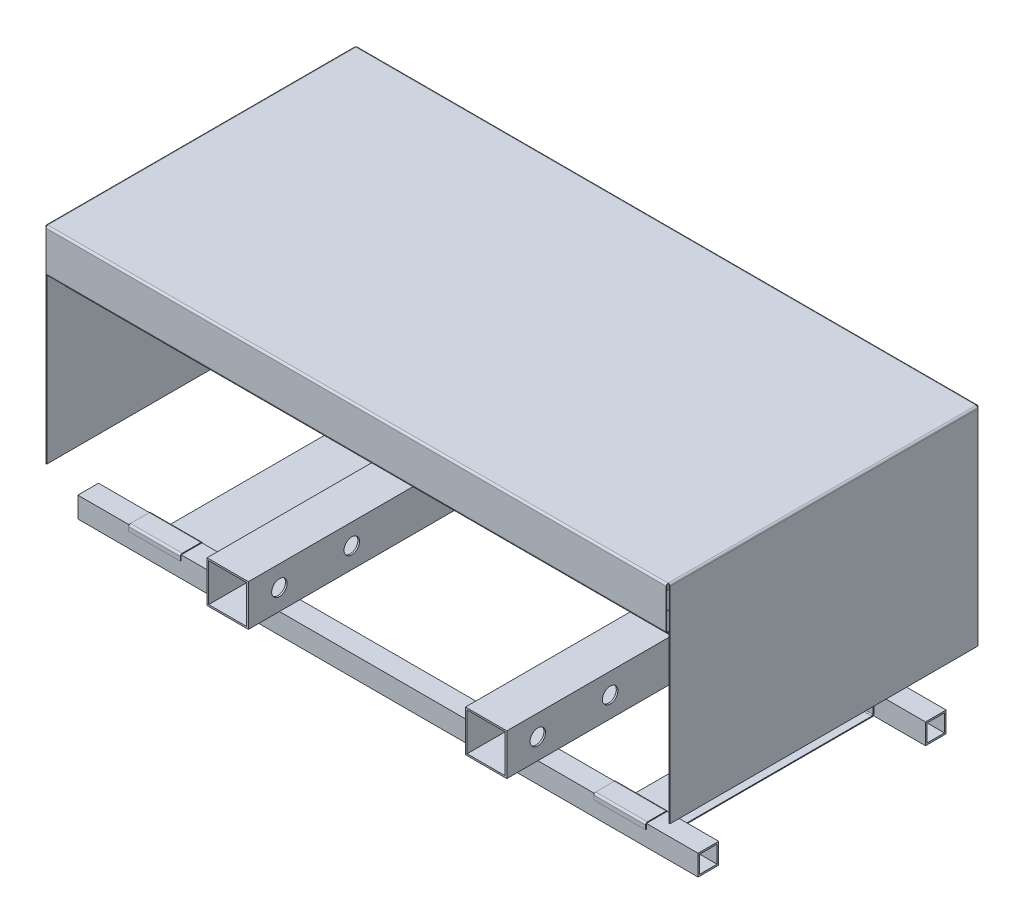
from build123d import *

# Parameters (mm, degrees)
CROQUIS11_W                      = 40
CROQUIS11_H                      = 40
CROQUIS11_W_2                    = 36.8
CROQUIS11_H_2                    = 36.8
CUADRADO_40X40X1_6_1_DEPTH       = 300
CROQUIS11_ON_SEGMENT_2_W         = 40
CROQUIS11_ON_SEGMENT_2_H         = 40
CROQUIS11_ON_SEGMENT_2_W_2       = 36.8
CROQUIS11_ON_SEGMENT_2_H_2       = 36.8
CUADRADO_40X40X1_6_1_2_DEPTH     = 300
CORTAR_EXTRUIR1_DEPTH            = 329.937684068
CORTAR_EXTRUIR1_DEPTH_BACK       = 329.937684068
CROQUIS12_R                      = 7.5
CUADRADO_START                   = -20
CUADRADO_20X20X1_6_1_OUTLINE_W   = 600
CUADRADO_20X20X1_6_1_OUTLINE_H   = 1.6
CUADRADO_20X20X1_6_1_DEPTH       = 20
CUADRADO_20X20X1_6_1_2_OUTLINE_W = 600
CUADRADO_20X20X1_6_1_2_OUTLINE_H = 16.8
CUADRADO_20X20X1_6_1_2_DEPTH     = 1.6
CUADRADO_START_2                 = -1.6
CUADRADO_20X20X1_6_1_3_OUTLINE_W = 600
CUADRADO_20X20X1_6_1_3_OUTLINE_H = 16.8
CUADRADO_20X20X1_6_1_3_DEPTH     = 1.6
CUADRADO_20X20X1_6_1_4_OUTLINE_W = 600
CUADRADO_20X20X1_6_1_4_OUTLINE_H = 1.6
CUADRADO_20X20X1_6_1_4_DEPTH     = 20
CUADRADO_20X20X1_6_1_5_OUTLINE_W = 600
CUADRADO_20X20X1_6_1_5_OUTLINE_H = 16.8
CUADRADO_20X20X1_6_1_5_DEPTH     = 1.6
CUADRADO_20X20X1_6_1_6_OUTLINE_W = 600
CUADRADO_20X20X1_6_1_6_OUTLINE_H = 16.8
CUADRADO_20X20X1_6_1_6_DEPTH     = 1.6
BRIDA_BASE1_DEPTH                = 50
BRIDA_START                      = -300
BRIDA_BASE2_DEPTH                = 600
BRIDA_DE_ARISTA1_DEPTH           = 298
BRIDA_DE_ARISTA1_BEND_DEPTH      = 298


# Read off the part's stored shape, not the designer's step: Cuadrado 20X20X1.6(1)
# Sheet-metal steps are written as plain solids
with BuildPart() as part:
    # Croquis11 → Cuadrado 40X40X1.6(1) (new body)
    with BuildSketch(Plane(origin=(-125, 20, 150), x_dir=(-1, 0, 0), z_dir=(0, 0, -1))):
        Rectangle(CROQUIS11_W, CROQUIS11_H)
        Rectangle(CROQUIS11_W_2, CROQUIS11_H_2, mode=Mode.SUBTRACT)
    extrude(amount=CUADRADO_40X40X1_6_1_DEPTH)


with BuildPart() as body_2:
    # Croquis11 on segment 2 (carried to segment 2) → Cuadrado 40X40X1.6_1 2 (new body)
    with BuildSketch(Plane(origin=(125, 20, 150), x_dir=(-1, 0, 0), z_dir=(0, 0, -1))):
        Rectangle(CROQUIS11_ON_SEGMENT_2_W, CROQUIS11_ON_SEGMENT_2_H)
        Rectangle(CROQUIS11_ON_SEGMENT_2_W_2, CROQUIS11_ON_SEGMENT_2_H_2, mode=Mode.SUBTRACT)
    extrude(amount=CUADRADO_40X40X1_6_1_2_DEPTH)


with BuildPart() as cortar_extruir1_tool:
    # Croquis12 → Cortar-Extruir1 (new, two sides: drawn at the far end of the back side and taken through both)
    with BuildSketch(Plane.ZY.offset(145).offset(-CORTAR_EXTRUIR1_DEPTH_BACK)):
        with Locations(Location((120, 20, 0), (0, 0, 180))):
            Circle(CROQUIS12_R)
        with Locations(Location((50, 20, 0), (0, 0, 180))):
            Circle(CROQUIS12_R)
        with Locations(Location((-50, 20, 0), (0, 0, 180))):
            Circle(CROQUIS12_R)
        with Locations(Location((-120, 20, 0), (0, 0, 180))):
            Circle(CROQUIS12_R)
    extrude(amount=CORTAR_EXTRUIR1_DEPTH + CORTAR_EXTRUIR1_DEPTH_BACK)


with BuildPart() as part_1:
    add(part.part)

    # Cortar-Extruir1: cut by cortar_extruir1_tool
    add(cortar_extruir1_tool.part, mode=Mode.SUBTRACT)


with BuildPart() as body_2_1:
    add(body_2.part)

    # Cortar-Extruir1: cut by cortar_extruir1_tool
    add(cortar_extruir1_tool.part, mode=Mode.SUBTRACT)


with BuildPart() as body_3:
    # Cuadrado 20X20X1.6(1) outline → Cuadrado 20X20X1.6(1) (new body)
    with BuildSketch(Plane(origin=(0, 0, 0), x_dir=(1, 0, 0), z_dir=(0, 1, 0)).offset(CUADRADO_START)):
        with Locations((0, 119.2)):
            Rectangle(CUADRADO_20X20X1_6_1_OUTLINE_W, CUADRADO_20X20X1_6_1_OUTLINE_H)
        with Locations((0, 100.8)):
            Rectangle(CUADRADO_20X20X1_6_1_OUTLINE_W, CUADRADO_20X20X1_6_1_OUTLINE_H)
    extrude(amount=CUADRADO_20X20X1_6_1_DEPTH)

    # Cuadrado 20X20X1.6_1 2 outline → Cuadrado 20X20X1.6_1 2 (add)
    with BuildSketch(Plane(origin=(0, 0, 0), x_dir=(1, 0, 0), z_dir=(0, 1, 0)).offset(CUADRADO_START)):
        with Locations((0, 110)):
            Rectangle(CUADRADO_20X20X1_6_1_2_OUTLINE_W, CUADRADO_20X20X1_6_1_2_OUTLINE_H)
    extrude(amount=CUADRADO_20X20X1_6_1_2_DEPTH)

    # Cuadrado 20X20X1.6_1 3 outline → Cuadrado 20X20X1.6_1 3 (add)
    with BuildSketch(Plane(origin=(0, 0, 0), x_dir=(1, 0, 0), z_dir=(0, 1, 0)).offset(CUADRADO_START_2)):
        with Locations((0, 110)):
            Rectangle(CUADRADO_20X20X1_6_1_3_OUTLINE_W, CUADRADO_20X20X1_6_1_3_OUTLINE_H)
    extrude(amount=CUADRADO_20X20X1_6_1_3_DEPTH)


with BuildPart() as body_4:
    # Cuadrado 20X20X1.6_1 4 outline → Cuadrado 20X20X1.6_1 4 (new body)
    with BuildSketch(Plane(origin=(0, 0, 0), x_dir=(1, 0, 0), z_dir=(0, 1, 0)).offset(CUADRADO_START)):
        with Locations((0, -100.8)):
            Rectangle(CUADRADO_20X20X1_6_1_4_OUTLINE_W, CUADRADO_20X20X1_6_1_4_OUTLINE_H)
        with Locations((0, -119.2)):
            Rectangle(CUADRADO_20X20X1_6_1_4_OUTLINE_W, CUADRADO_20X20X1_6_1_4_OUTLINE_H)
    extrude(amount=CUADRADO_20X20X1_6_1_4_DEPTH)

    # Cuadrado 20X20X1.6_1 5 outline → Cuadrado 20X20X1.6_1 5 (add)
    with BuildSketch(Plane(origin=(0, 0, 0), x_dir=(1, 0, 0), z_dir=(0, 1, 0)).offset(CUADRADO_START)):
        with Locations((0, -110)):
            Rectangle(CUADRADO_20X20X1_6_1_5_OUTLINE_W, CUADRADO_20X20X1_6_1_5_OUTLINE_H)
    extrude(amount=CUADRADO_20X20X1_6_1_5_DEPTH)

    # Cuadrado 20X20X1.6_1 6 outline → Cuadrado 20X20X1.6_1 6 (add)
    with BuildSketch(Plane(origin=(0, 0, 0), x_dir=(1, 0, 0), z_dir=(0, 1, 0)).offset(CUADRADO_START_2)):
        with Locations((0, -110)):
            Rectangle(CUADRADO_20X20X1_6_1_6_OUTLINE_W, CUADRADO_20X20X1_6_1_6_OUTLINE_H)
    extrude(amount=CUADRADO_20X20X1_6_1_6_DEPTH)


with BuildPart() as body_5:
    # Croquis15 → Brida base1 (new body)
    with BuildSketch(Plane.ZY.offset(250)):
        with BuildLine():
            Line((-120, -5), (-120, -1))
            ThreePointArc((-120, -1), (-119.707106781, -0.292893219), (-119, 0))
            Line((-119, 0), (-101, 0))
            ThreePointArc((-101, 0), (-100.292893219, -0.292893219), (-100, -1))
            Line((-100, -1), (-100, -18.2))
            ThreePointArc((-100, -18.2), (-99.472792206, -19.472792206), (-98.2, -20))
            Line((-98.2, -20), (98.2, -20))
            ThreePointArc((98.2, -20), (99.472792206, -19.472792206), (100, -18.2))
            Line((100, -18.2), (100, -1))
            ThreePointArc((100, -1), (100.292893219, -0.292893219), (101, 0))
            Line((101, 0), (119, 0))
            ThreePointArc((119, 0), (119.707106781, -0.292893219), (120, -1))
            Line((120, -1), (120, -5))
            Line((120, -5), (120.8, -5))
            Line((120.8, -5), (120.8, -1))
            ThreePointArc((120.8, -1), (120.272792206, 0.272792206), (119, 0.8))
            Line((119, 0.8), (101, 0.8))
            ThreePointArc((101, 0.8), (99.727207794, 0.272792206), (99.2, -1))
            Line((99.2, -1), (99.2, -18.2))
            ThreePointArc((99.2, -18.2), (98.907106781, -18.907106781), (98.2, -19.2))
            Line((98.2, -19.2), (-98.2, -19.2))
            ThreePointArc((-98.2, -19.2), (-98.907106781, -18.907106781), (-99.2, -18.2))
            Line((-99.2, -18.2), (-99.2, -1))
            ThreePointArc((-99.2, -1), (-99.727207794, 0.272792206), (-101, 0.8))
            Line((-101, 0.8), (-119, 0.8))
            ThreePointArc((-119, 0.8), (-120.272792206, 0.272792206), (-120.8, -1))
            Line((-120.8, -1), (-120.8, -5))
            Line((-120.8, -5), (-120, -5))
        make_face()
    extrude(amount=-BRIDA_BASE1_DEPTH)


with BuildPart() as body_6:
    # Simetría1: mirrored copy
    add(body_5.part.mirror(Plane(origin=(0, 0, 0), x_dir=(0, 0, 1), z_dir=(1, 0, 0))))


with BuildPart() as body_7:
    # Croquis22 → Brida base2 (new body)
    with BuildSketch(Plane(origin=(0, 0, 0), x_dir=(0, 0, -1), z_dir=(1, 0, 0)).offset(BRIDA_START)):
        with BuildLine():
            Line((150, 40), (150, 239))
            ThreePointArc((150, 239), (149.707106781, 239.707106781), (149, 240))
            Line((149, 240), (-149, 240))
            ThreePointArc((-149, 240), (-149.707106781, 239.707106781), (-150, 239))
            Line((-150, 239), (-150, 201))
            ThreePointArc((-150, 201), (-149.707106781, 200.292893219), (-149, 200))
            Line((-149, 200), (-131.8, 200))
            ThreePointArc((-131.8, 200), (-130.527207794, 199.472792206), (-130, 198.2))
            Line((-130, 198.2), (-130, 180))
            Line((-130, 180), (-130.8, 180))
            Line((-130.8, 180), (-130.8, 198.2))
            ThreePointArc((-130.8, 198.2), (-131.092893219, 198.907106781), (-131.8, 199.2))
            Line((-131.8, 199.2), (-149, 199.2))
            ThreePointArc((-149, 199.2), (-150.272792206, 199.727207794), (-150.8, 201))
            Line((-150.8, 201), (-150.8, 239))
            ThreePointArc((-150.8, 239), (-150.272792206, 240.272792206), (-149, 240.8))
            Line((-149, 240.8), (149, 240.8))
            ThreePointArc((149, 240.8), (150.272792206, 240.272792206), (150.8, 239))
            Line((150.8, 239), (150.8, 40))
            Line((150.8, 40), (150, 40))
        make_face()
    extrude(amount=BRIDA_BASE2_DEPTH)

    # Brida de arista1 section (across the edge) → Brida de arista1 (add)
    with BuildSketch(Plane(origin=(301, 240, -149), x_dir=(-1, 0, 0), z_dir=(0, 0, 1))):
        with BuildLine():
            Line((-0.8, 1), (-0.8, 200))
            Line((-0.8, 200), (0, 200))
            Line((0, 200), (0, 1))
            ThreePointArc((0, 1), (0.292893219, 0.292893219), (1, 0))
            Line((1, 0), (1, -0.8))
            ThreePointArc((1, -0.8), (-0.272792206, -0.272792206), (-0.8, 1))
        make_face()
    extrude(amount=BRIDA_DE_ARISTA1_DEPTH)

    # Brida de arista1 section 2 (across the edge) → Brida de arista1 bend (add)
    with BuildSketch(Plane(origin=(-301, 240, 149), x_dir=(1, 0, 0), z_dir=(0, 0, -1))):
        with BuildLine():
            Line((-0.8, 1), (-0.8, 200))
            Line((-0.8, 200), (0, 200))
            Line((0, 200), (0, 1))
            ThreePointArc((0, 1), (0.292893219, 0.292893219), (1, 0))
            Line((1, 0), (1, -0.8))
            ThreePointArc((1, -0.8), (-0.272792206, -0.272792206), (-0.8, 1))
        make_face()
    extrude(amount=BRIDA_DE_ARISTA1_BEND_DEPTH)


solid = Compound([part_1.part, body_2_1.part, body_3.part, body_4.part, body_5.part, body_6.part, body_7.part])
